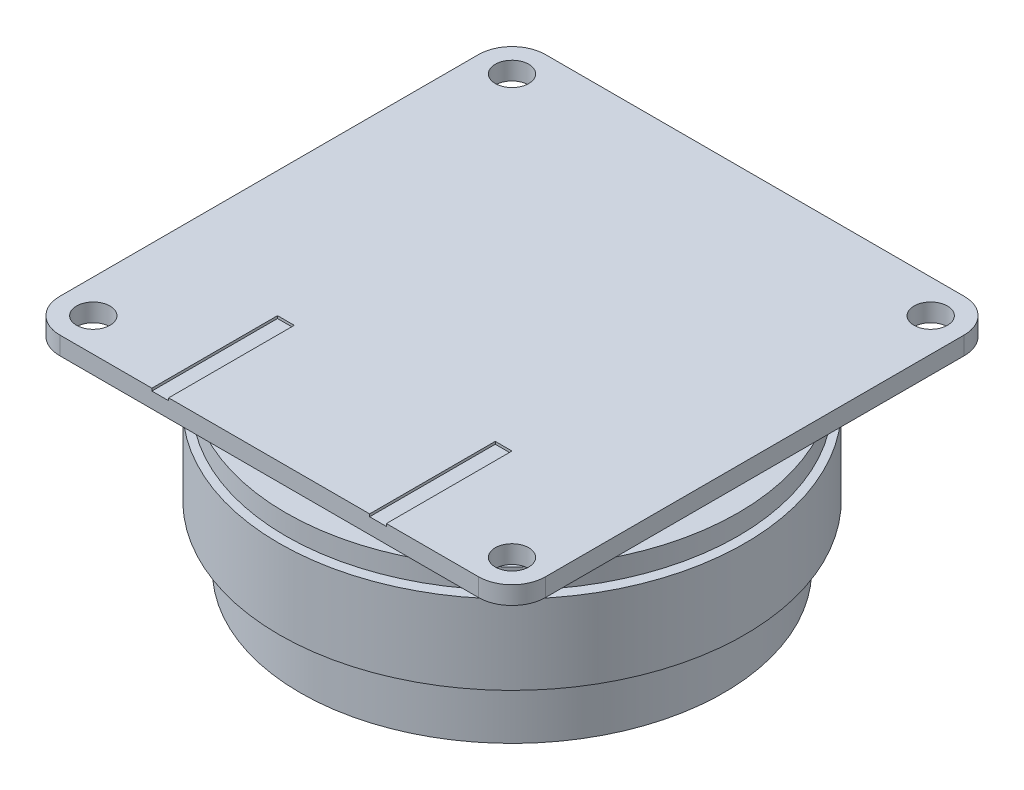
from build123d import *

# Parameters (mm, degrees)
SKETCH1_R              = 20
BOSS_EXTRUDE1_DEPTH    = 7.25
SKETCH2_R              = 22.5
BOSS_EXTRUDE2_DEPTH    = 4.5
SKETCH3_R              = 27
BOSS_EXTRUDE3_DEPTH    = 2.4
CUT_EXTRUDE1_REACH     = 42.721
SKETCH4_R              = 1
SKETCH5_R              = 23.5
BOSS_EXTRUDE4_DEPTH    = 2.5
SKETCH6_R              = 20.5
BOSS_EXTRUDE5_DEPTH    = 1
SKETCH8_R              = 17.25
BOSS_EXTRUDE8_DEPTH    = 1.25
SKETCH10_R             = 2
BOSS_EXTRUDE10_DEPTH   = 2.15
SKETCH11_W             = 2
SKETCH11_H             = 15
CUT_EXTRUDE2_DEPTH     = 0.3
THICKEN1_START         = -5.3
THICKEN1_OUTLINE_R     = 25.3
THICKEN1_DEPTH         = 5
THICKEN1_START_2       = 1.95
THICKEN1_2_OUTLINE_R   = 27.8
THICKEN1_2_OUTLINE_R_2 = 22.8
THICKEN1_2_DEPTH       = 9.8
THICKEN1_START_3       = -0.3
THICKEN1_3_OUTLINE_R   = 25.3
THICKEN1_3_OUTLINE_R_2 = 20.3
THICKEN1_3_DEPTH       = 7.25
SKETCH12_R             = 27.8
SKETCH12_R_2           = 22.8
CUT_EXTRUDE3_DEPTH     = 0.35


# Read off the part's stored shape, not the designer's step: Thicken1
with BuildPart() as part:
    # Sketch1 → Boss-Extrude1 (new body)
    with BuildSketch(Plane(origin=(0, 0, 0), x_dir=(1, 0, 0), z_dir=(0, 1, 0))):
        with Locations(Location((0, 0, 0), (0, 0, 90))):
            Circle(SKETCH1_R)
    extrude(amount=BOSS_EXTRUDE1_DEPTH)

    # Sketch2 → Boss-Extrude2 (add)
    with BuildSketch(Plane(origin=(0, 7.25, 0), x_dir=(1, 0, 0), z_dir=(0, 1, 0))):
        with Locations(Location((0, 0, 0), (0, 0, 270))):
            Circle(SKETCH2_R)
    extrude(amount=BOSS_EXTRUDE2_DEPTH)

    # Sketch3 → Boss-Extrude3 (add)
    with BuildSketch(Plane(origin=(0, 11.75, 0), x_dir=(1, 0, 0), z_dir=(0, 1, 0))):
        with Locations(Location((0, 0, 0), (0, 0, 270))):
            Circle(SKETCH3_R)
    extrude(amount=BOSS_EXTRUDE3_DEPTH)

    # Sketch4 → Cut-Extrude1 (cut, up to next)
    with BuildSketch(Plane(origin=(0, 14.15, 0), x_dir=(1, 0, 0), z_dir=(0, 1, 0)), mode=Mode.PRIVATE) as cut_extrude1_sk1:
        with Locations(Location((17.735675135, -15.417387181, 0), (0, 0, 270))):
            Circle(SKETCH4_R)
    cut_extrude1_tool1 = extrude(cut_extrude1_sk1.sketch, amount=-CUT_EXTRUDE1_REACH, mode=Mode.PRIVATE) & part.part
    # Sketch4 → Cut-Extrude1 (cut, up to next)
    with BuildSketch(Plane(origin=(0, 14.15, 0), x_dir=(1, 0, 0), z_dir=(0, 1, 0)), mode=Mode.PRIVATE) as cut_extrude1_sk2:
        with Locations(Location((-4.484011391, -23.068238811, 0), (0, 0, 270))):
            Circle(SKETCH4_R)
    cut_extrude1_tool2 = extrude(cut_extrude1_sk2.sketch, amount=-CUT_EXTRUDE1_REACH, mode=Mode.PRIVATE) & part.part
    # Sketch4 → Cut-Extrude1 (cut, up to next)
    with BuildSketch(Plane(origin=(0, 14.15, 0), x_dir=(1, 0, 0), z_dir=(0, 1, 0)), mode=Mode.PRIVATE) as cut_extrude1_sk3:
        with Locations(Location((-22.219686527, -7.65085163, 0), (0, 0, 270))):
            Circle(SKETCH4_R)
    cut_extrude1_tool3 = extrude(cut_extrude1_sk3.sketch, amount=-CUT_EXTRUDE1_REACH, mode=Mode.PRIVATE) & part.part
    # Sketch4 → Cut-Extrude1 (cut, up to next)
    with BuildSketch(Plane(origin=(0, 14.15, 0), x_dir=(1, 0, 0), z_dir=(0, 1, 0)), mode=Mode.PRIVATE) as cut_extrude1_sk4:
        with Locations(Location((-17.735675135, 15.417387181, 0), (0, 0, 270))):
            Circle(SKETCH4_R)
    cut_extrude1_tool4 = extrude(cut_extrude1_sk4.sketch, amount=-CUT_EXTRUDE1_REACH, mode=Mode.PRIVATE) & part.part
    # Sketch4 → Cut-Extrude1 (cut, up to next)
    with BuildSketch(Plane(origin=(0, 14.15, 0), x_dir=(1, 0, 0), z_dir=(0, 1, 0)), mode=Mode.PRIVATE) as cut_extrude1_sk5:
        with Locations(Location((4.484011391, 23.068238811, 0), (0, 0, 270))):
            Circle(SKETCH4_R)
    cut_extrude1_tool5 = extrude(cut_extrude1_sk5.sketch, amount=-CUT_EXTRUDE1_REACH, mode=Mode.PRIVATE) & part.part
    # Sketch4 → Cut-Extrude1 (cut, up to next)
    with BuildSketch(Plane(origin=(0, 14.15, 0), x_dir=(1, 0, 0), z_dir=(0, 1, 0)), mode=Mode.PRIVATE) as cut_extrude1_sk6:
        with Locations(Location((22.219686527, 7.65085163, 0), (0, 0, 270))):
            Circle(SKETCH4_R)
    cut_extrude1_tool6 = extrude(cut_extrude1_sk6.sketch, amount=-CUT_EXTRUDE1_REACH, mode=Mode.PRIVATE) & part.part
    add(cut_extrude1_tool1.solids().sort_by_distance((17.735675, 14.15, 15.417387))[0], mode=Mode.SUBTRACT)
    add(cut_extrude1_tool2.solids().sort_by_distance((-4.484011, 14.15, 23.068239))[0], mode=Mode.SUBTRACT)
    add(cut_extrude1_tool3.solids().sort_by_distance((-22.219687, 14.15, 7.650852))[0], mode=Mode.SUBTRACT)
    add(cut_extrude1_tool4.solids().sort_by_distance((-17.735675, 14.15, -15.417387))[0], mode=Mode.SUBTRACT)
    add(cut_extrude1_tool5.solids().sort_by_distance((4.484011, 14.15, -23.068239))[0], mode=Mode.SUBTRACT)
    add(cut_extrude1_tool6.solids().sort_by_distance((22.219687, 14.15, -7.650852))[0], mode=Mode.SUBTRACT)

    # Sketch5 → Boss-Extrude4 (add)
    with BuildSketch(Plane(origin=(0, 14.15, 0), x_dir=(1, 0, 0), z_dir=(0, 1, 0))):
        with Locations(Location((0, 0, 0), (0, 0, 81.438302268))):
            Circle(SKETCH5_R)
    extrude(amount=BOSS_EXTRUDE4_DEPTH)

    # Sketch6 → Boss-Extrude5 (add)
    with BuildSketch(Plane(origin=(0, 16.65, 0), x_dir=(1, 0, 0), z_dir=(0, 1, 0))):
        with Locations(Location((0, 0, 0), (0, 0, 270))):
            Circle(SKETCH6_R)
    extrude(amount=BOSS_EXTRUDE5_DEPTH)

    # Cut-Sweep1: sweep along a curve in space
    with BuildLine() as cut_sweep1_path:
        ThreePointArc((0, 17.65, 20.5), (14.495689014, 17.65, 14.495689014), (20.5, 17.65, 0))
        ThreePointArc((20.5, 17.65, 0), (14.495689014, 17.65, -14.495689014), (0, 17.65, -20.5))
        ThreePointArc((0, 17.65, -20.5), (-14.495689014, 17.65, -14.495689014), (-20.5, 17.65, 0))
        ThreePointArc((-20.5, 17.65, 0), (-14.495689014, 17.65, 14.495689014), (0, 17.65, 20.5))
    # Sketch7 → Cut-Sweep1 (sweep, cut)
    with BuildSketch(Plane.XY):
        with BuildLine():
            Line((20.5, 17.65), (20.5, 14.4))
            ThreePointArc((20.5, 14.4), (18.201902961, 15.351902961), (17.25, 17.65))
            Line((17.25, 17.65), (20.5, 17.65))
        make_face()
    sweep(path=cut_sweep1_path.line, mode=Mode.SUBTRACT)

    # Sketch8 → Boss-Extrude8 (add)
    with BuildSketch(Plane(origin=(0, 17.65, 0), x_dir=(1, 0, 0), z_dir=(0, 1, 0))):
        with Locations(Location((0, 0, 0), (0, 0, 270))):
            Circle(SKETCH8_R)
    extrude(amount=BOSS_EXTRUDE8_DEPTH)

    # Sketch10 → Boss-Extrude10 (add)
    with BuildSketch(Plane(origin=(0, 18.9, 0), x_dir=(1, 0, 0), z_dir=(0, 1, 0))):
        with BuildLine():
            Line((-25, -29), (25, -29))
            ThreePointArc((25, -29), (27.828427125, -27.828427125), (29, -25))
            Line((29, -25), (29, 25))
            ThreePointArc((29, 25), (27.828427125, 27.828427125), (25, 29))
            Line((25, 29), (-25, 29))
            ThreePointArc((-25, 29), (-27.828427125, 27.828427125), (-29, 25))
            Line((-29, 25), (-29, -25))
            ThreePointArc((-29, -25), (-27.828427125, -27.828427125), (-25, -29))
        make_face()
        with Locations(Location((-25, 25, 0), (0, 0, 90))):
            Circle(SKETCH10_R, mode=Mode.SUBTRACT)
        with Locations(Location((25, 25, 0), (0, 0, 90))):
            Circle(SKETCH10_R, mode=Mode.SUBTRACT)
        with Locations(Location((25, -25, 0), (0, 0, 90))):
            Circle(SKETCH10_R, mode=Mode.SUBTRACT)
        with Locations(Location((-25, -25, 0), (0, 0, 90))):
            Circle(SKETCH10_R, mode=Mode.SUBTRACT)
    extrude(amount=BOSS_EXTRUDE10_DEPTH)

    # Sketch11 → Cut-Extrude2 (cut)
    with BuildSketch(Plane(origin=(0, 21.05, 0), x_dir=(1, 0, 0), z_dir=(0, 1, 0))):
        with Locations((-13, -21.5)):
            Rectangle(SKETCH11_W, SKETCH11_H)
        with Locations((13, -21.5)):
            Rectangle(SKETCH11_W, SKETCH11_H)
    extrude(amount=-CUT_EXTRUDE2_DEPTH, mode=Mode.SUBTRACT)


with BuildPart() as body_2:
    # Thicken1 outline → Thicken1 (new body)
    with BuildSketch(Plane(origin=(0, 0, 0), x_dir=(1, 0, 0), z_dir=(0, 1, 0)).offset(THICKEN1_START)):
        Circle(THICKEN1_OUTLINE_R)
    extrude(amount=THICKEN1_DEPTH)



with BuildPart() as body_3:
    # Thicken1 2 outline → Thicken1 2 (new body)
    with BuildSketch(Plane(origin=(0, 0, 0), x_dir=(1, 0, 0), z_dir=(0, 1, 0)).offset(THICKEN1_START_2)):
        Circle(THICKEN1_2_OUTLINE_R)
        Circle(THICKEN1_2_OUTLINE_R_2, mode=Mode.SUBTRACT)
    extrude(amount=THICKEN1_2_DEPTH)


with BuildPart() as body_2_1:
    add(body_2.part)

    add(body_3.part)  # Thicken1 3 merges body 3
    # Thicken1 3 outline → Thicken1 3 (add)
    with BuildSketch(Plane(origin=(0, 0, 0), x_dir=(1, 0, 0), z_dir=(0, 1, 0)).offset(THICKEN1_START_3)):
        Circle(THICKEN1_3_OUTLINE_R)
        Circle(THICKEN1_3_OUTLINE_R_2, mode=Mode.SUBTRACT)
    extrude(amount=THICKEN1_3_DEPTH)

    # Sketch12 → Cut-Extrude3 (cut)
    with BuildSketch(Plane(origin=(0, 11.75, 0), x_dir=(1, 0, 0), z_dir=(0, 1, 0))):
        with Locations(Location((0, 0, 0), (0, 0, 270))):
            Circle(SKETCH12_R)
        with Locations(Location((0, 0, 0), (0, 0, 270))):
            Circle(SKETCH12_R_2, mode=Mode.SUBTRACT)
    extrude(amount=-CUT_EXTRUDE3_DEPTH, mode=Mode.SUBTRACT)


solid = Compound([part.part, body_2_1.part])
